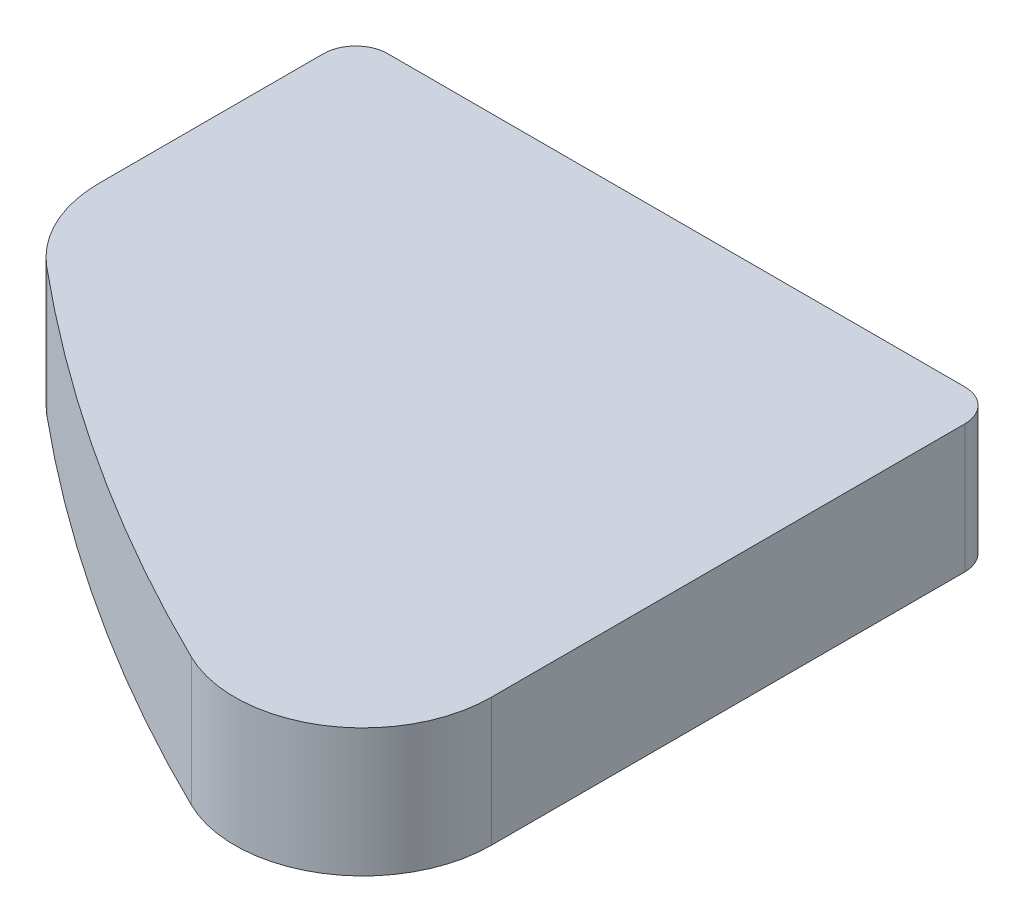
from build123d import *

# Parameters (mm, degrees)
STOCK_SHORT_HANDLE_L_1_START = -1
STOCK_SHORT_HANDLE_L_1_DEPTH = 2
FILLET1_R                    = 0.5


# Read off the part's stored shape, not the designer's step: Stock-short-handle_L-1
with BuildPart() as part:
    # Stock-short-handle_L-1 outline → Stock-short-handle_L-1 (new body)
    with BuildSketch(Plane(origin=(0, 0, 0), x_dir=(1, 0, 0), z_dir=(0, 1, 0)).offset(STOCK_SHORT_HANDLE_L_1_START)):
        with BuildLine():
            Line((5, -39.585762407), (-5, -39.585762407))
            Line((-5, -39.585762407), (-5, -43.585762407))
            ThreePointArc((-5, -43.585762407), (-4.810860404, -44.434752748), (-4.279215401, -45.123165398))
            ThreePointArc((-4.279215401, -45.123165398), (-1.203063357, -47.386267754), (2.120784599, -49.266793861))
            ThreePointArc((2.120784599, -49.266793861), (4.058671148, -49.167239185), (5, -47.470414091))
            Line((5, -47.470414091), (5, -39.585762407))
        make_face()
    extrude(amount=STOCK_SHORT_HANDLE_L_1_DEPTH)

    # Fillet1
    fillet1_edges = [part.edges().sort_by_distance(p)[0] for p in [
        (5, 0, 39.585762407),
        (-5, 0, 39.585762407),
    ]]
    fillet(fillet1_edges, radius=FILLET1_R)


solid = part.part
